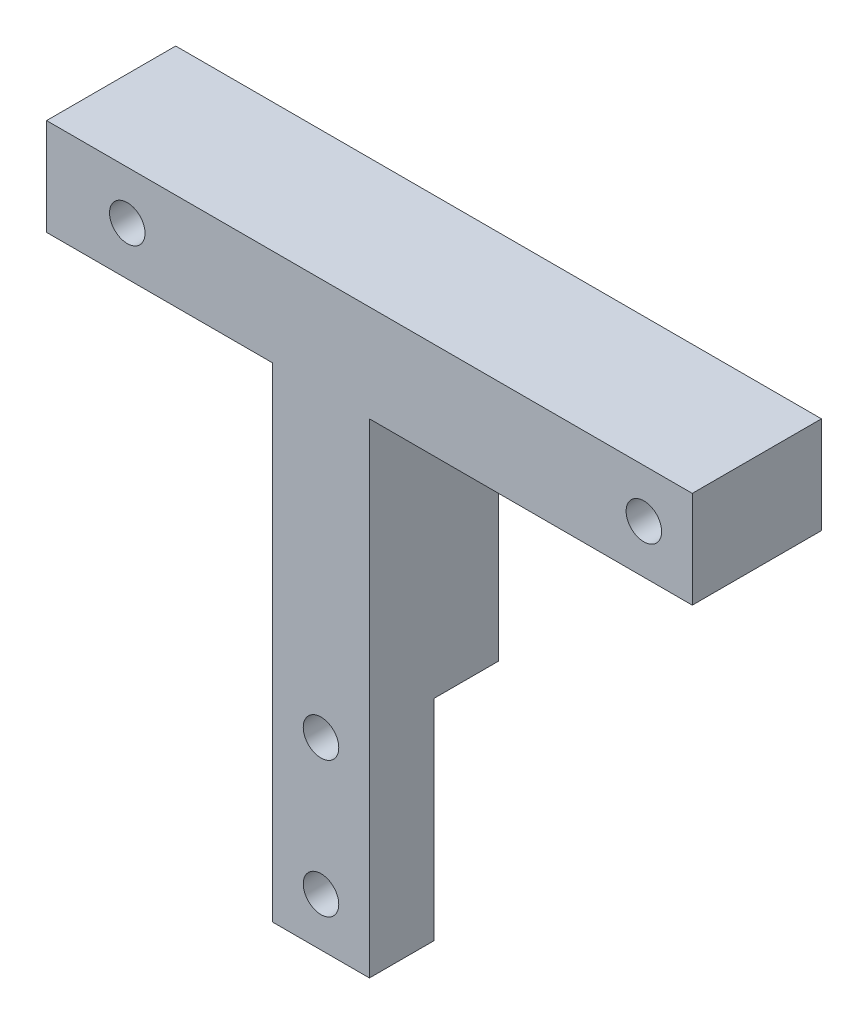
from build123d import *

# Parameters (mm, degrees)
SKETCH_1_R          = 0.55
EXTRUDE_2_DEPTH     = 4
SKETCH_3_W          = 3
SKETCH_3_H          = 6.5
SKETCH_3_R          = 0.55
CUT_EXTRUDE_2_DEPTH = 2


with BuildPart() as part:
    # 草图1 → 凸台-拉伸2 (new body)
    with BuildSketch(Plane.XY):
        Polygon((0, -1.5), (10, -1.5), (10, 1.5), (-10, 1.5), (-10, -1.5), (-3, -1.5), (-3, -16.5), (0, -16.5), align=None)
        with Locations((-7.5, 0)):
            Circle(SKETCH_1_R, mode=Mode.SUBTRACT)
        with Locations((8.5, 0)):
            Circle(SKETCH_1_R, mode=Mode.SUBTRACT)
        with Locations((-1.5, -15)):
            Circle(SKETCH_1_R, mode=Mode.SUBTRACT)
        with Locations((-1.5, -10.8)):
            Circle(SKETCH_1_R, mode=Mode.SUBTRACT)
    extrude(amount=EXTRUDE_2_DEPTH)

    # 草图3 → 切除-拉伸2 (cut)
    with BuildSketch(Plane(origin=(0, 0, 0), x_dir=(-1, 0, 0), z_dir=(0, 0, -1))):
        with Locations((1.5, -13.25)):
            Rectangle(SKETCH_3_W, SKETCH_3_H)
        with Locations((1.5, -15)):
            Circle(SKETCH_3_R, mode=Mode.SUBTRACT)
        with Locations((1.5, -10.8)):
            Circle(SKETCH_3_R, mode=Mode.SUBTRACT)
    extrude(amount=-CUT_EXTRUDE_2_DEPTH, mode=Mode.SUBTRACT)


solid = part.part
